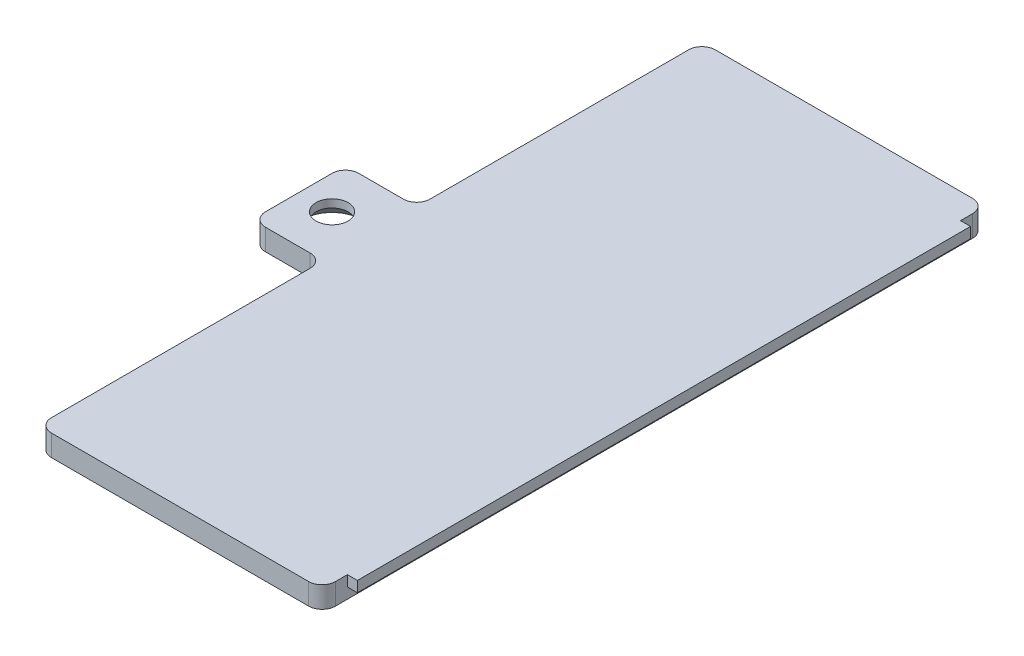
from build123d import *

# Parameters (mm, degrees)
DOOR_PLATE_1_6_CENTRED_SCREW_TAB_DEPTH        = 1.6
SCREW_HOLE_2_4_FREE_SKETCH_R                  = 1.2
SCREW_HOLE_2_4_FREE_DEPTH                     = 72.791312148
SCREW_CSK_90DEG_M2_SIZE                       = 1
HOOK_FLANGE_0_75_X_0_8_INNER_FACE_P_2_W       = 0.9
HOOK_FLANGE_0_75_X_0_8_INNER_FACE_P_2_H       = 46
HOOK_FLANGE_0_75_X_0_8_INNER_FACE_PLANE_DEPTH = 0.8
DOOR_CORNERS_R1_PRINT_R                       = 1


with BuildPart() as part:
    # Door Plate 1.6 + centred screw tab Sketch → Door Plate 1.6 + centred screw tab (new body)
    with BuildSketch(Plane(origin=(0, 0, 0), x_dir=(1, 0, 0), z_dir=(0, 1, 0))):
        Polygon((9.35, 15.1), (30.65, 15.1), (30.65, 64.9), (9.35, 64.9), (9.35, 43.5), (4, 43.5), (4, 36.5), (9.35, 36.5), align=None)
    extrude(amount=DOOR_PLATE_1_6_CENTRED_SCREW_TAB_DEPTH)

    # Screw Hole 2.4 (free) Sketch → Screw Hole 2.4 (free) (cut, through all)
    with BuildSketch(Plane(origin=(0, 0, 0), x_dir=(1, 0, 0), z_dir=(0, 1, 0))):
        with Locations((6.5, 40)):
            Circle(SCREW_HOLE_2_4_FREE_SKETCH_R)
    extrude(amount=SCREW_HOLE_2_4_FREE_DEPTH, mode=Mode.SUBTRACT)

    # Screw CSK 90deg (M2)
    screw_csk_90deg_m2_edges = [part.edges().sort_by_distance(p)[0] for p in [
        (5.3, 0, -40),
    ]]
    chamfer(screw_csk_90deg_m2_edges, length=SCREW_CSK_90DEG_M2_SIZE)

    # Hook Flange 0.75 x 0.8 _inner-face p 2 → Hook Flange 0.75 x 0.8 _inner-face plane (add)
    with BuildSketch(Plane(origin=(0, 0.8, 0), x_dir=(1, 0, 0), z_dir=(0, 1, 0))):
        with Locations((30.95, 40)):
            Rectangle(HOOK_FLANGE_0_75_X_0_8_INNER_FACE_P_2_W, HOOK_FLANGE_0_75_X_0_8_INNER_FACE_P_2_H)
    extrude(amount=HOOK_FLANGE_0_75_X_0_8_INNER_FACE_PLANE_DEPTH)

    # Door Corners R1 (print)
    door_corners_r1_print_edges = [part.edges().sort_by_distance(p)[0] for p in [
        (9.35, 0.8, -36.5),
        (4, 0.8, -36.5),
        (4, 0.8, -43.5),
        (9.35, 0.8, -43.5),
        (9.35, 0.8, -64.9),
        (30.65, 0.8, -64.9),
        (30.65, 0.8, -15.1),
        (9.35, 0.8, -15.1),
    ]]
    fillet(door_corners_r1_print_edges, radius=DOOR_CORNERS_R1_PRINT_R)


solid = part.part
